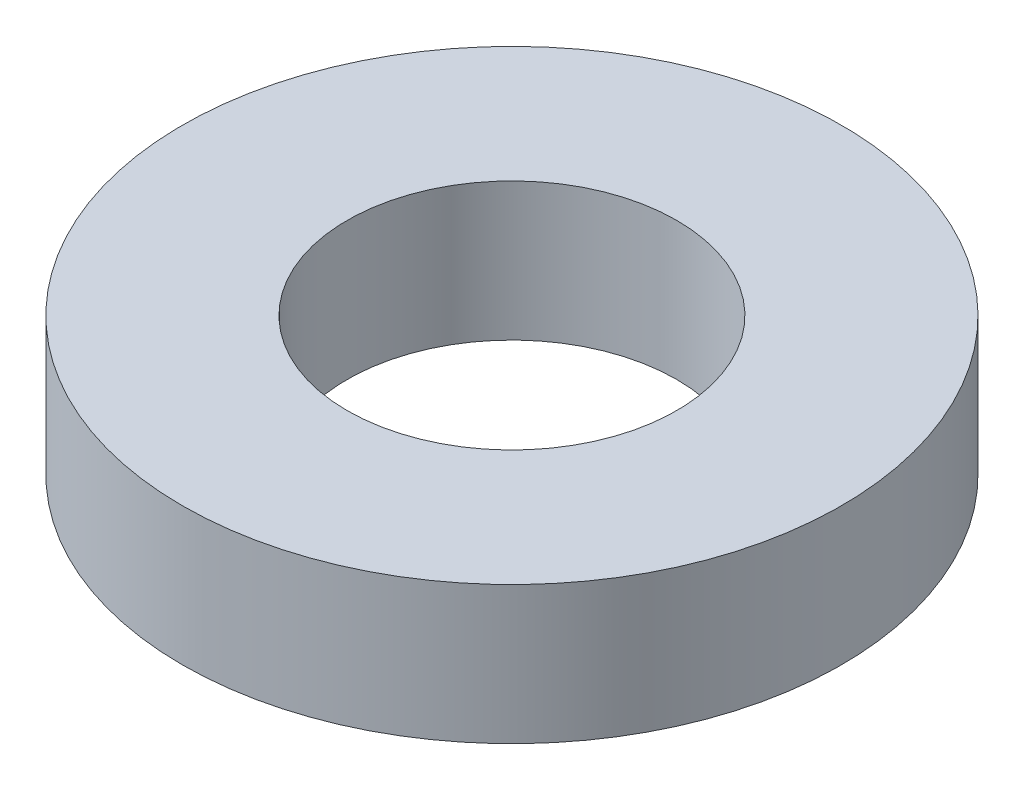
from build123d import *

# Parameters (mm, degrees)
SKETCH1_R           = 55
BOSS_EXTRUDE1_DEPTH = 23
SKETCH2_R           = 27.5
CUT_EXTRUDE1_DEPTH  = 82.111035008


with BuildPart() as part:
    # Sketch1 → Boss-Extrude1 (new body)
    with BuildSketch(Plane(origin=(0, 0, 0), x_dir=(1, 0, 0), z_dir=(0, 1, 0))):
        Circle(SKETCH1_R)
    extrude(amount=BOSS_EXTRUDE1_DEPTH)

    # Sketch2 → Cut-Extrude1 (cut, through all)
    with BuildSketch(Plane(origin=(0, 0, 0), x_dir=(1, 0, 0), z_dir=(0, 1, 0))):
        Circle(SKETCH2_R)
    extrude(amount=CUT_EXTRUDE1_DEPTH, mode=Mode.SUBTRACT)


solid = part.part
